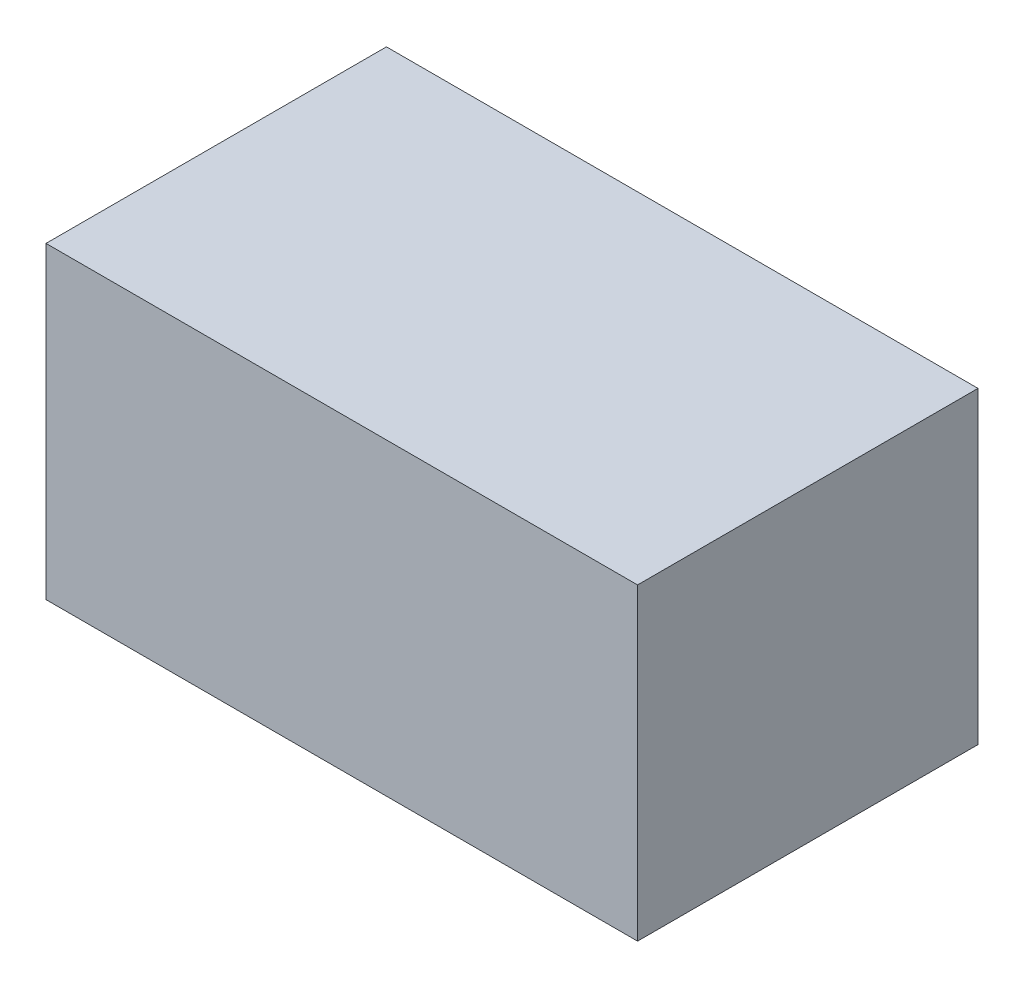
from build123d import *

# Parameters (mm, degrees)
SKETCH1_W           = 29.53979912
SKETCH1_H           = 15.405724453
BOSS_EXTRUDE1_DEPTH = 17
SKETCH3_W           = 1
SKETCH3_H           = 3.5
CUT_EXTRUDE2_DEPTH  = 2


# Read off the part's stored shape, not the designer's step: Cavity1
with BuildPart() as part:
    # Sketch1 → Boss-Extrude1 (new body)
    with BuildSketch(Plane.XY):
        with Locations((7.049151698, 0.989576641)):
            Rectangle(SKETCH1_W, SKETCH1_H)
    extrude(amount=BOSS_EXTRUDE1_DEPTH)

    # Cavity1 outline → Cavity1 (revolve, cut)
    with BuildSketch(Plane(origin=(7.02830498, 0, 0), x_dir=(1, 0, 0), z_dir=(0, 0, 1))):
        Polygon((13.126805589, -4), (7.414213562, 0), (13.414213562, 6), (13.414213562, 8), (0, 8), (0, -6), (13.126805589, -6), align=None)
    revolve(axis=Axis((7.02830498, 0, 0), (0, 1, 0)), mode=Mode.SUBTRACT)

    # Sketch3 → Cut-Extrude2 (cut)
    with BuildSketch(Plane(origin=(0, 0, 0), x_dir=(-1, 0, 0), z_dir=(0, 0, -1))):
        with Locations((-19.819051258, 0.597141886)):
            Rectangle(SKETCH3_W, SKETCH3_H)
        with Locations((5.720747862, 0.597141886)):
            Rectangle(SKETCH3_W, SKETCH3_H)
    extrude(amount=-CUT_EXTRUDE2_DEPTH, mode=Mode.SUBTRACT)


solid = part.part
